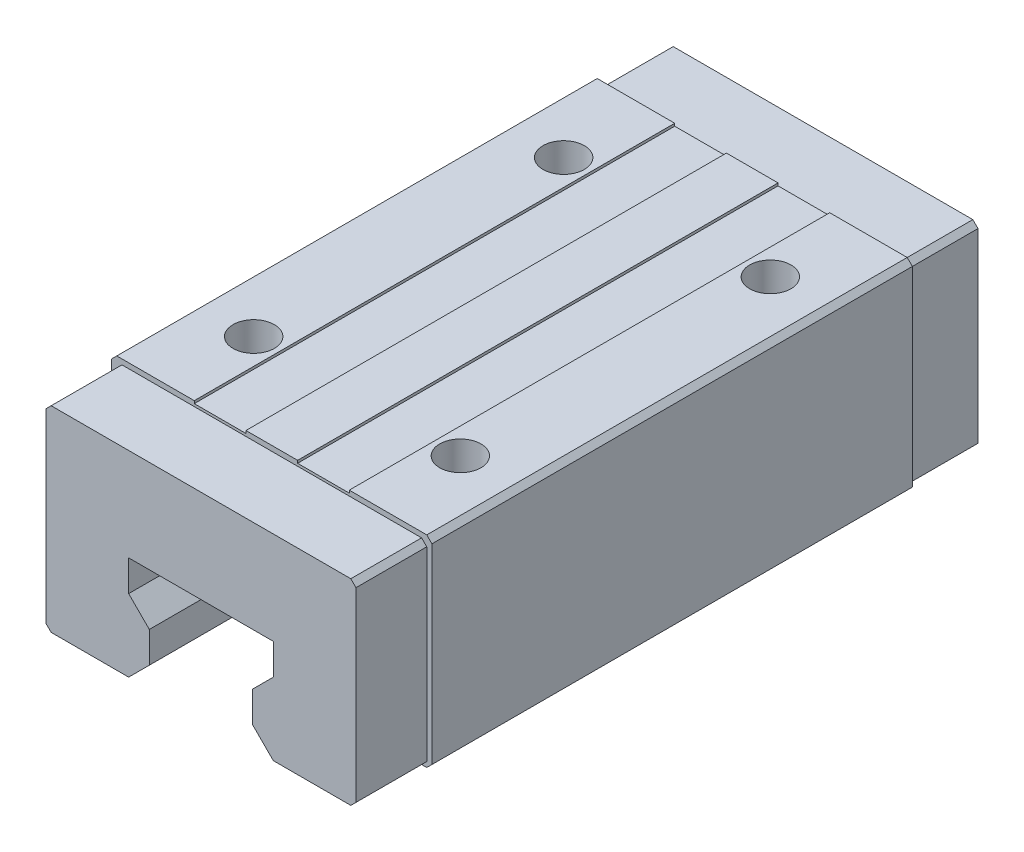
from build123d import *

# Parameters (mm, degrees)
EXTRUDE_1_DEPTH     = 120.4
EXTRUDE_2_DEPTH     = 46.5
SKETCH_4_R          = 4
CUT_EXTRUDE_1_DEPTH = 10
CHAMFER_1_SIZE      = 1


with BuildPart() as part:
    # 草图1 → 凸台-拉伸1 (new body)
    with BuildSketch(Plane.XY):
        Polygon((-30, 38), (30, 38), (30, 0), (14, 0), (10, 4), (10, 10), (14, 14), (14, 20), (-14, 20), (-14, 14), (-10, 10), (-10, 4), (-14, 0), (-30, 0), align=None)
    extrude(amount=EXTRUDE_1_DEPTH)

    # 草图2 → 凸台-拉伸2 (add, symmetric)
    with BuildSketch(Plane.XY.offset(60.2)):
        Polygon((-31, 0), (-30, 0), (-30, 38), (30, 38), (30, 0), (31, 0), (31, 39), (15, 39), (15, 38.5), (5, 38.5), (5, 39), (-5, 39), (-5, 38.5), (-15, 38.5), (-15, 39), (-31, 39), align=None)
    extrude(amount=EXTRUDE_2_DEPTH, both=True)

    # 草图4 → 切除-拉伸1 (cut)
    with BuildSketch(Plane(origin=(0, 39, 0), x_dir=(1, 0, 0), z_dir=(0, 1, 0))):
        with Locations(Location((20, -30.2, 0), (0, 0, 270))):
            Circle(SKETCH_4_R)
        with Locations(Location((20, -90.2, 0), (0, 0, 270))):
            Circle(SKETCH_4_R)
        with Locations(Location((-20, -90.2, 0), (0, 0, 90))):
            Circle(SKETCH_4_R)
        with Locations(Location((-20, -30.2, 0), (0, 0, 90))):
            Circle(SKETCH_4_R)
    extrude(amount=-CUT_EXTRUDE_1_DEPTH, mode=Mode.SUBTRACT)

    # 倒角1
    chamfer_1_edges = [part.edges().sort_by_distance(p)[0] for p in [
        (30, 0, 113.55),
        (31, 0, 60.2),
        (30, 0, 6.85),
        (-30, 38, 6.85),
        (30, 38, 6.85),
        (31, 39, 60.2),
        (30, 38, 113.55),
        (-31, 39, 60.2),
        (-30, 38, 113.55),
        (-30, 0, 6.85),
        (-30, 0, 113.55),
        (-31, 0, 60.2),
    ]]
    chamfer(chamfer_1_edges, length=CHAMFER_1_SIZE - 0.0001)  # a hair under: the kernel refuses the full size


solid = part.part
